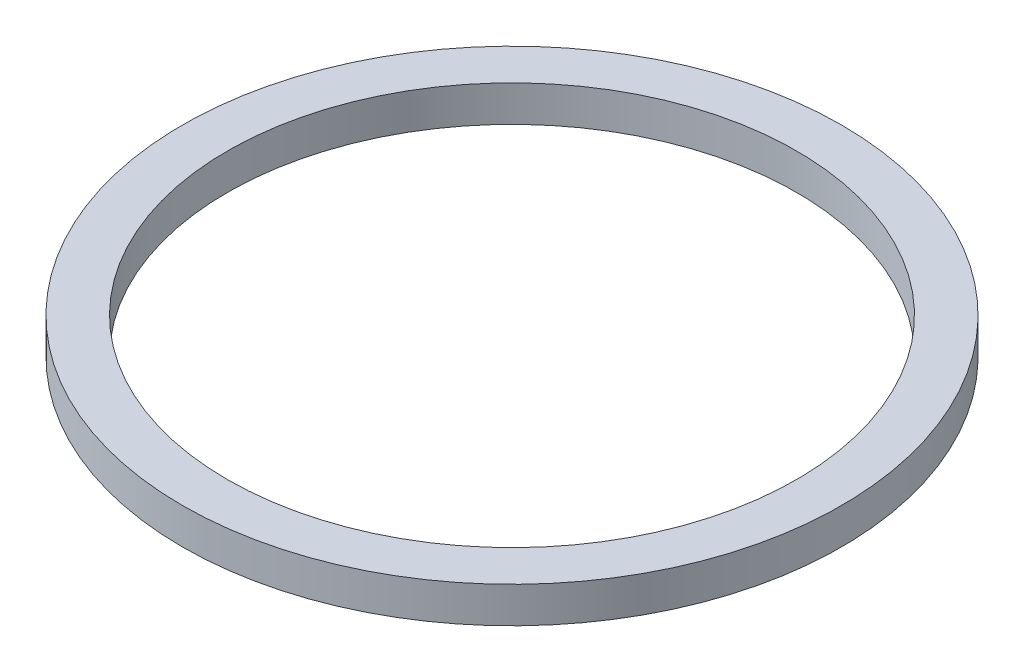
from build123d import *

# Parameters (mm, degrees)
SKETCH1_R           = 55
BOSS_EXTRUDE1_DEPTH = 6
SKETCH2_R           = 47.5
CUT_EXTRUDE1_DEPTH  = 79.012819459


with BuildPart() as part:
    # Sketch1 → Boss-Extrude1 (new body)
    with BuildSketch(Plane(origin=(0, 0, 0), x_dir=(1, 0, 0), z_dir=(0, 1, 0))):
        Circle(SKETCH1_R)
    extrude(amount=BOSS_EXTRUDE1_DEPTH)

    # Sketch2 → Cut-Extrude1 (cut, through all)
    with BuildSketch(Plane(origin=(0, 0, 0), x_dir=(1, 0, 0), z_dir=(0, 1, 0))):
        Circle(SKETCH2_R)
    extrude(amount=CUT_EXTRUDE1_DEPTH, mode=Mode.SUBTRACT)


solid = part.part
